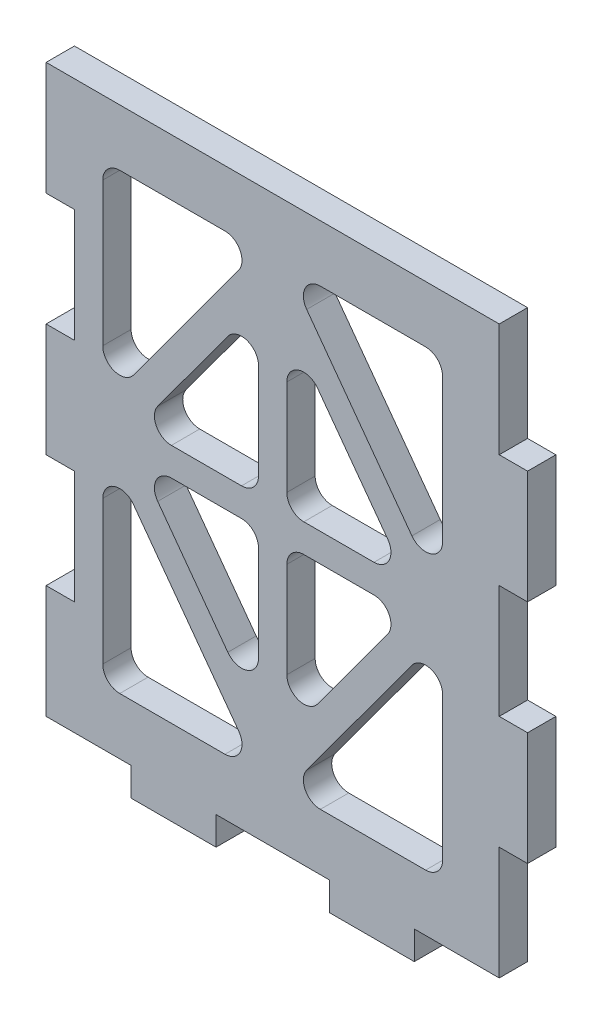
from build123d import *

# Parameters (mm, degrees)
BOXSIDE_DEPTH      = 6.35
CUT_EXTRUDE1_DEPTH = 91.47357349
FILLET1_R          = 3.81


with BuildPart() as part:
    # Sketch1 → BOXSIDE (new body)
    with BuildSketch(Plane.XY):
        Polygon((-50.8, 38.1), (-50.8, 63.5), (50.8, 63.5), (50.8, 38.1), (57.15, 38.1), (57.15, 12.7), (50.8, 12.7), (50.8, -12.7), (57.15, -12.7), (57.15, -38.1), (50.8, -38.1), (50.8, -63.5), (31.75, -63.5), (31.75, -69.85), (12.7, -69.85), (12.7, -63.5), (-12.7, -63.5), (-12.7, -69.85), (-31.75, -69.85), (-31.75, -63.5), (-50.8, -63.5), (-50.8, -38.1), (-44.45, -38.1), (-44.45, -12.7), (-50.8, -12.7), (-50.8, 12.7), (-44.45, 12.7), (-44.45, 38.1), align=None)
    extrude(amount=BOXSIDE_DEPTH)

    # Sketch2 → Cut-Extrude1 (cut, through all)
    with BuildSketch(Plane.XY.offset(6.35)):
        Polygon((-38.1, 50.8), (-3.175, 50.8), (-38.1, 3.175), align=None)
        Polygon((-3.175, 40.062106567), (-3.175, 3.175), (-30.225544816, 3.175), align=None)
        Polygon((30.225544816, 3.175), (3.175, 40.062106567), (3.175, 3.175), align=None)
        Polygon((38.1, 3.175), (38.1, 50.8), (3.175, 50.8), align=None)
        Polygon((38.1, -50.8), (3.175, -50.8), (38.1, -3.175), align=None)
        Polygon((3.175, -40.062106567), (3.175, -3.175), (30.225544816, -3.175), align=None)
        Polygon((-30.225544816, -3.175), (-3.175, -40.062106567), (-3.175, -3.175), align=None)
        Polygon((-38.1, -3.175), (-38.1, -50.8), (-3.175, -50.8), align=None)
    extrude(amount=-CUT_EXTRUDE1_DEPTH, mode=Mode.SUBTRACT)

    # Fillet1
    fillet1_edges = [part.edges().sort_by_distance(p)[0] for p in [
        (-3.175, -50.8, 3.175),
        (-38.1, -3.175, 3.175),
        (-38.1, -50.8, 3.175),
        (3.175, -50.8, 3.175),
        (38.1, -50.8, 3.175),
        (38.1, -3.175, 3.175),
        (3.175, -40.062106567, 3.175),
        (-3.175, -40.062106567, 3.175),
        (-30.225544816, -3.175, 3.175),
        (3.175, -3.175, 3.175),
        (30.225544816, -3.175, 3.175),
        (-3.175, -3.175, 3.175),
        (-3.175, 3.175, 3.175),
        (-3.175, 40.062106567, 3.175),
        (-30.225544816, 3.175, 3.175),
        (-38.1, 3.175, 3.175),
        (30.225544816, 3.175, 3.175),
        (3.175, 40.062106567, 3.175),
        (3.175, 3.175, 3.175),
        (38.1, 3.175, 3.175),
        (38.1, 50.8, 3.175),
        (-3.175, 50.8, 3.175),
        (3.175, 50.8, 3.175),
        (-38.1, 50.8, 3.175),
    ]]
    fillet(fillet1_edges, radius=FILLET1_R)


solid = part.part
